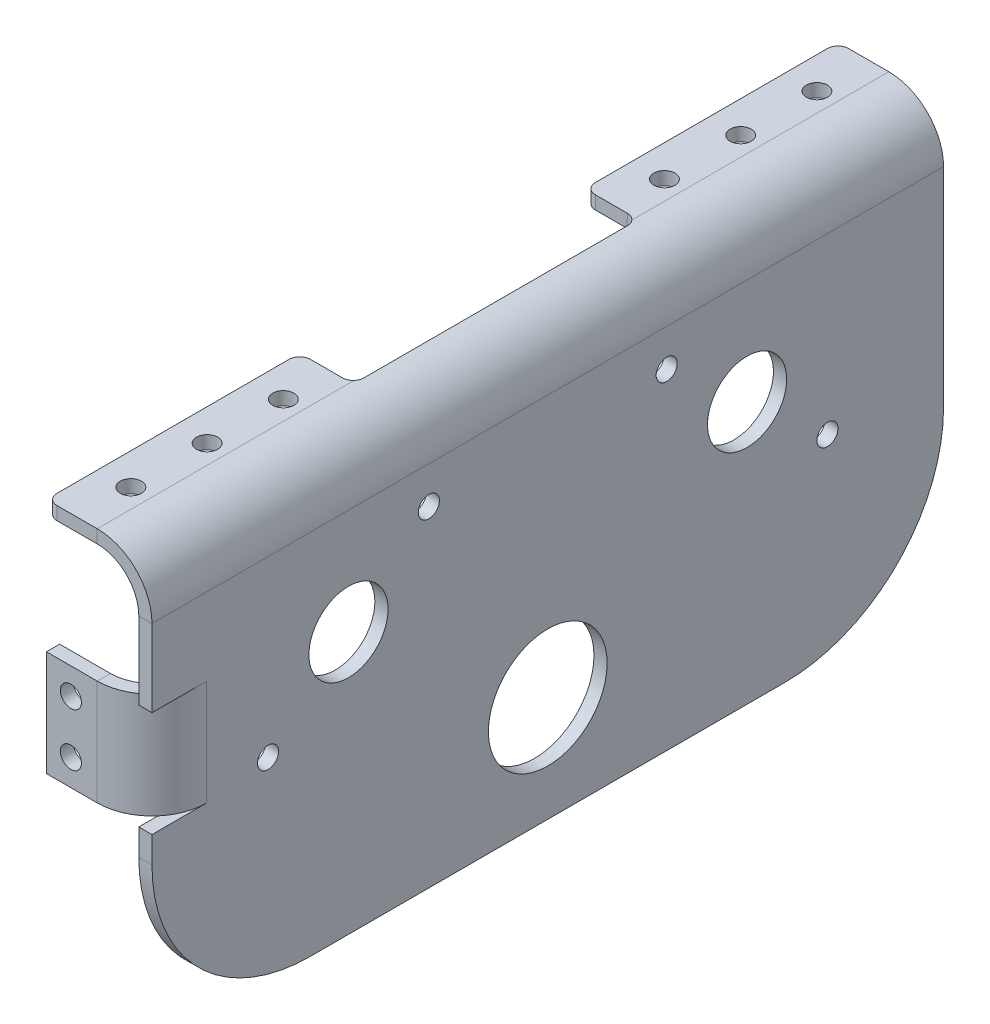
from build123d import *

# Parameters (mm, degrees)
SKETCH1_W                    = 190.5
SKETCH1_H                    = 101.6
BOSS_EXTRUDE1_DEPTH          = 3.175
SKETCH2_R                    = 14.2875
CUT_EXTRUDE1_DEPTH           = 3.175
EDGE_FLANGE1_STRIP_W         = 32.7
EDGE_FLANGE1_STRIP_H         = 3.175
EDGE_FLANGE1_STRIP_CUT_DEPTH = 190.5
EDGE_FLANGE1_DEPTH           = 190.5
SKETCH12_R                   = 9.525
SKETCH12_R_2                 = 2.54
CUT_EXTRUDE2_DEPTH           = 27.94
FILLET1_R                    = 38.1
SKETCH15_W                   = 3.175
SKETCH15_H                   = 25.4
BOSS_EXTRUDE2_DEPTH          = 0.000254
EDGE_FLANGE4_STRIP_W         = 32.7
EDGE_FLANGE4_STRIP_H         = 3.175
EDGE_FLANGE4_STRIP_CUT_DEPTH = 25.4
EDGE_FLANGE4_DEPTH           = 25.4
SKETCH26_R                   = 2.54
CUT_EXTRUDE3_DEPTH           = 142.028796748
SKETCH27_R                   = 2.54
CUT_EXTRUDE4_DEPTH           = 199.405991339
CUT_EXTRUDE5_START           = -34.29
CUT_EXTRUDE5_DEPTH           = 68.58
FILLET2_R                    = 2.54


# Read off the part's stored shape, not the designer's step: Cut-Extrude5
# Sheet-metal steps are written as plain solids
with BuildPart() as part:
    # Sketch1 → Boss-Extrude1 (new body)
    with BuildSketch(Plane(origin=(0, 0, 0), x_dir=(0, 0, -1), z_dir=(1, 0, 0))):
        Rectangle(SKETCH1_W, SKETCH1_H)
    extrude(amount=BOSS_EXTRUDE1_DEPTH)

    # Sketch2 → Cut-Extrude1 (cut)
    with BuildSketch(Plane(origin=(3.175, 0, 0), x_dir=(0, 0, -1), z_dir=(1, 0, 0))):
        with Locations((0, -25.4)):
            Circle(SKETCH2_R)
    extrude(amount=-CUT_EXTRUDE1_DEPTH, mode=Mode.SUBTRACT)

    # Edge-Flange1 strip (across the edge) → Edge-Flange1 strip cut (cut)
    with BuildSketch(Plane(origin=(0, 50.8, 95.25), x_dir=(0, -1, 0), z_dir=(0, 0, -1))):
        with Locations((-3.175, -1.5875)):
            Rectangle(EDGE_FLANGE1_STRIP_W, EDGE_FLANGE1_STRIP_H)
    extrude(amount=EDGE_FLANGE1_STRIP_CUT_DEPTH, mode=Mode.SUBTRACT)

    # Edge-Flange1 section (across the edge) → Edge-Flange1 (add)
    with BuildSketch(Plane(origin=(0, 50.8, 95.25), x_dir=(0, -1, 0), z_dir=(0, 0, -1))):
        with BuildLine():
            Line((0, 10), (0, 22.225))
            Line((0, 22.225), (3.175, 22.225))
            Line((3.175, 22.225), (3.175, 10))
            ThreePointArc((3.175, 10), (6.103932188, 2.928932188), (13.175, 0))
            Line((13.175, 0), (13.175, -3.175))
            ThreePointArc((13.175, -3.175), (3.858868158, 0.683868158), (0, 10))
        make_face()
    extrude(amount=EDGE_FLANGE1_DEPTH)

    # Sketch12 → Cut-Extrude2 (cut)
    with BuildSketch(Plane(origin=(3.175, 0, 0), x_dir=(0, 0, -1), z_dir=(1, 0, 0))):
        with Locations((-47.963329482, 12.225)):
            Circle(SKETCH12_R)
        with Locations((-28.616658964, 28.683017495)):
            Circle(SKETCH12_R_2)
        with Locations((-67.31, -4.233017495)):
            Circle(SKETCH12_R_2)
        with Locations((47.963329482, 12.225)):
            Circle(SKETCH12_R)
        with Locations((28.616658964, 28.683017495)):
            Circle(SKETCH12_R_2)
        with Locations((67.31, -4.233017495)):
            Circle(SKETCH12_R_2)
    extrude(amount=-CUT_EXTRUDE2_DEPTH, mode=Mode.SUBTRACT)

    # Fillet1
    fillet1_edges = [part.edges().sort_by_distance(p)[0] for p in [
        (1.5875, -50.8, 95.25),
        (1.5875, -50.8, -95.25),
    ]]
    fillet(fillet1_edges, radius=FILLET1_R)

    # Sketch15 → Boss-Extrude2 (add)
    with BuildSketch(Plane.XY.offset(95.25)):
        with Locations((1.5875, 6.35)):
            Rectangle(SKETCH15_W, SKETCH15_H)
    extrude(amount=BOSS_EXTRUDE2_DEPTH)

    # Edge-Flange4 strip (across the edge) → Edge-Flange4 strip cut (cut)
    with BuildSketch(Plane(origin=(0, -6.35, 95.250254), x_dir=(0, 0, -1), z_dir=(0, 1, 0))):
        with Locations((-3.175, -1.5875)):
            Rectangle(EDGE_FLANGE4_STRIP_W, EDGE_FLANGE4_STRIP_H)
    extrude(amount=EDGE_FLANGE4_STRIP_CUT_DEPTH, mode=Mode.SUBTRACT)

    # Edge-Flange4 section (across the edge) → Edge-Flange4 (add)
    with BuildSketch(Plane(origin=(0, -6.35, 95.250254), x_dir=(0, 0, -1), z_dir=(0, 1, 0))):
        with BuildLine():
            Line((0, 10), (0, 22.225))
            Line((0, 22.225), (3.175, 22.225))
            Line((3.175, 22.225), (3.175, 10))
            ThreePointArc((3.175, 10), (6.103932188, 2.928932188), (13.175, 0))
            Line((13.175, 0), (13.175, -3.175))
            ThreePointArc((13.175, -3.175), (3.858868158, 0.683868158), (0, 10))
        make_face()
    extrude(amount=EDGE_FLANGE4_DEPTH)

    # Sketch26 → Cut-Extrude3 (cut, through all)
    with BuildSketch(Plane(origin=(0, 50.8, 0), x_dir=(1, 0, 0), z_dir=(0, 1, 0))):
        with Locations(Location((-14.605, -82.55, 0), (0, 0, 180))):
            Circle(SKETCH26_R)
        with Locations(Location((-14.605, -64.205555556, 0), (0, 0, 180))):
            Circle(SKETCH26_R)
        with Locations(Location((-14.605, -45.861111111, 0), (0, 0, 180))):
            Circle(SKETCH26_R)
        with Locations(Location((-14.605, -27.516666667, 0), (0, 0, 180))):
            Circle(SKETCH26_R)
        with Locations(Location((-14.605, -9.172222222, 0), (0, 0, 180))):
            Circle(SKETCH26_R)
        with Locations(Location((-14.605, 9.172222222, 0), (0, 0, 180))):
            Circle(SKETCH26_R)
        with Locations(Location((-14.605, 27.516666667, 0), (0, 0, 180))):
            Circle(SKETCH26_R)
        with Locations(Location((-14.605, 45.861111111, 0), (0, 0, 180))):
            Circle(SKETCH26_R)
        with Locations(Location((-14.605, 64.205555556, 0), (0, 0, 180))):
            Circle(SKETCH26_R)
        with Locations(Location((-14.605, 82.55, 0), (0, 0, 180))):
            Circle(SKETCH26_R)
    extrude(amount=-CUT_EXTRUDE3_DEPTH, mode=Mode.SUBTRACT)

    # Sketch27 → Cut-Extrude4 (cut, through all)
    with BuildSketch(Plane.XY.offset(95.250254)):
        with Locations((-16.35, 12.7)):
            Circle(SKETCH27_R)
        with Locations((-16.35, 0)):
            Circle(SKETCH27_R)
    extrude(amount=-CUT_EXTRUDE4_DEPTH, mode=Mode.SUBTRACT)

    # Cut-Extrude5 outline → Cut-Extrude5 (cut)
    with BuildSketch(Plane.XY.offset(CUT_EXTRUDE5_START)):
        with BuildLine():
            ThreePointArc((-10, 47.625), (-9.762432951, 47.622177697), (-9.525, 47.61371238))
            Line((-9.525, 47.61371238), (-9.3741875, 50.78512856))
            ThreePointArc((-9.3741875, 50.78512856), (-9.687005413, 50.796281615), (-10, 50.8))
            Line((-10, 50.8), (-22.225, 50.8))
            Line((-22.225, 50.8), (-22.225, 47.625))
            Line((-22.225, 47.625), (-10, 47.625))
        make_face()
    extrude(amount=CUT_EXTRUDE5_DEPTH, mode=Mode.SUBTRACT)

    # Fillet2
    fillet2_edges = [part.edges().sort_by_distance(p)[0] for p in [
        (-22.225, 49.2125, 95.25),
        (-22.225, 49.2125, 34.29),
        (-9.44959375, 49.19942047, 34.29),
        (-9.44959375, 49.19942047, -34.29),
        (-22.225, 49.2125, -34.29),
        (-22.225, 49.2125, -95.25),
    ]]
    fillet(fillet2_edges, radius=FILLET2_R)


solid = part.part
